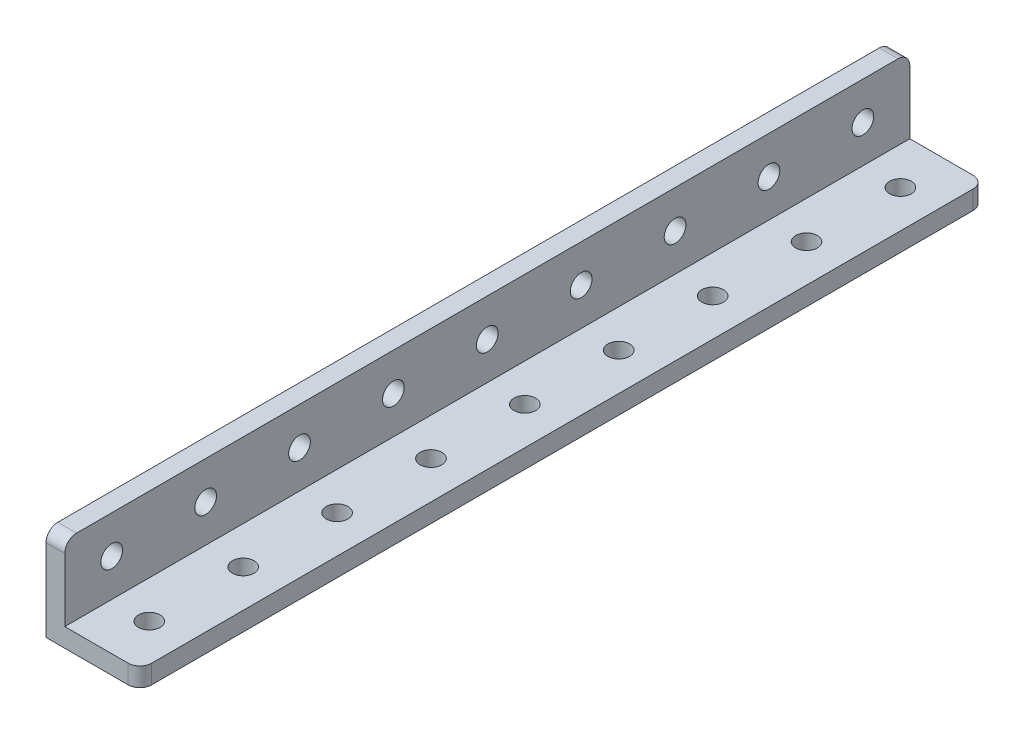
from build123d import *

# Parameters (mm, degrees)
SKETCH1_W                      = 144
SKETCH1_H                      = 16
BOSS_EXTRUDE1_DEPTH            = 16
SKETCH2_W                      = 12.8
SKETCH2_H                      = 12.8
CUT_EXTRUDE1_DEPTH             = 146.766937266
F_3_7_3_7_DIAMETER_HOLE1_D     = 3.7
F_3_7_3_7_DIAMETER_HOLE1_DEPTH = 16
F_3_7_3_7_DIAMETER_HOLE2_D     = 3.7
F_3_7_3_7_DIAMETER_HOLE2_DEPTH = 16
FILLET1_R                      = 2


with BuildPart() as part:
    # Sketch1 → Boss-Extrude1 (new body)
    with BuildSketch(Plane(origin=(16, 0, 0), x_dir=(0, 0, -1), z_dir=(1, 0, 0))):
        with Locations((72, 8)):
            Rectangle(SKETCH1_W, SKETCH1_H)
    extrude(amount=-BOSS_EXTRUDE1_DEPTH)

    # Sketch2 → Cut-Extrude1 (cut, through all)
    with BuildSketch(Plane.XY):
        with Locations((9.6, 9.6)):
            Rectangle(SKETCH2_W, SKETCH2_H)
    extrude(amount=-CUT_EXTRUDE1_DEPTH, mode=Mode.SUBTRACT)

    # Ø3.7 (3.7) Diameter Hole1
    with Locations(Plane.ZY):
        with Locations((-24, 9.6), (-40, 9.6), (-56, 9.6), (-72, 9.6), (-88, 9.6), (-104, 9.6), (-120, 9.6), (-136, 9.6), (-8, 9.6)):
            Hole(F_3_7_3_7_DIAMETER_HOLE1_D / 2, depth=F_3_7_3_7_DIAMETER_HOLE1_DEPTH)

    # Ø3.7 (3.7) Diameter Hole2
    with Locations(Plane(origin=(0, 0, 0), x_dir=(-1, 0, 0), z_dir=(0, -1, 0))):
        with Locations((-9.6, 24), (-9.6, 40), (-9.6, 56), (-9.6, 72), (-9.6, 88), (-9.6, 104), (-9.6, 120), (-9.6, 136), (-9.6, 8)):
            Hole(F_3_7_3_7_DIAMETER_HOLE2_D / 2, depth=F_3_7_3_7_DIAMETER_HOLE2_DEPTH)

    # Fillet1
    fillet1_edges = [part.edges().sort_by_distance(p)[0] for p in [
        (1.6, 16, -144),
        (1.6, 16, 0),
        (16, 1.6, -144),
        (16, 1.6, 0),
    ]]
    fillet(fillet1_edges, radius=FILLET1_R)


solid = part.part
